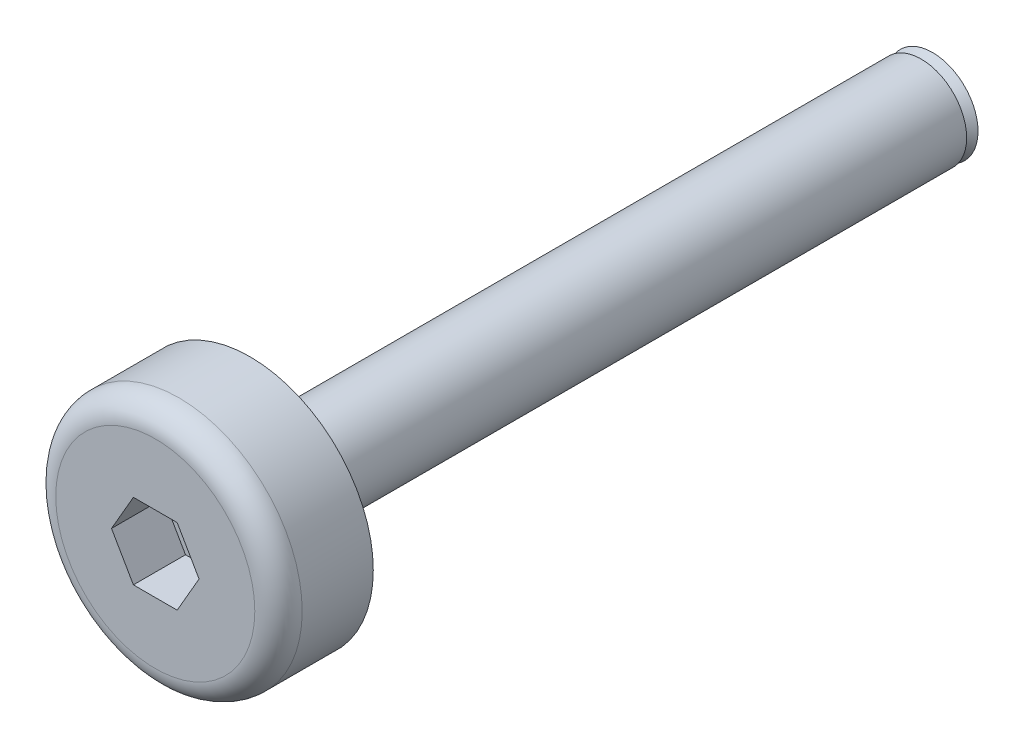
from build123d import *

# Parameters (mm, degrees)
F_0075_CYLINDER_SKETCH_R    = 3.25
F_0075_CYLINDER_DEPTH       = 2.5
F_0076_FILLET_R             = 0.625
F_0077_EXTRUDE_DEPTH        = 1.385
F_0077_EXTRUDE_ROTATE_ANGLE = 120
F_0080_CYLINDER_SKETCH_R    = 1.2
F_0080_CYLINDER_DEPTH       = 17.7
F_0081_CONE_ROTATE_ANGLE    = 90


with BuildPart() as part:
    # 0075_cylinder_Sketch → 0075_cylinder (new body)
    with BuildSketch(Plane.XY):
        Circle(F_0075_CYLINDER_SKETCH_R)
    extrude(amount=F_0075_CYLINDER_DEPTH)

    # 0076_fillet
    f_0076_fillet_edges = [part.edges().sort_by_distance(p)[0] for p in [
        (-3.25, 0, 2.5),
    ]]
    fillet(f_0076_fillet_edges, radius=F_0076_FILLET_R)


with BuildPart() as body_2:
    # 0077_extrude_Sketch → 0077_extrude (new body)
    with BuildSketch(Plane.XY):
        Polygon((0, 0), (1.154700538, 0), (1.732050808, 1), (1.154700538, 2), (0, 2), (-0.577350269, 1), align=None)
    extrude(amount=F_0077_EXTRUDE_DEPTH)


with BuildPart() as body_2_1:
    # 0077_extrude_Rotate: read off the stored shape, not the designer's step
    # 0077_extrude_Rotate: moved
    add(body_2.part.rotate(Axis((0, 0, 0), (0, 0, 1)), F_0077_EXTRUDE_ROTATE_ANGLE))


with BuildPart() as body_2_2:
    # 0077_extrude_Translate: moved
    add(body_2_1.part.moved(Location((1.154700538, 0, 1.125))))


with BuildPart() as part_1:
    add(part.part)

    # 0079_sub: cut body 2
    add(body_2_2.part, mode=Mode.SUBTRACT)


with BuildPart() as body_2_2_1:
    # 0080_cylinder_Sketch → 0080_cylinder (new body)
    with BuildSketch(Plane.XY):
        Circle(F_0080_CYLINDER_SKETCH_R)
    extrude(amount=F_0080_CYLINDER_DEPTH)


with BuildPart() as body_2_2_2:
    # 0080_cylinder_Translate: moved
    add(body_2_2_1.part.moved(Location((0, 0, -17.7))))


with BuildPart() as body_3:
    # 0081_cone_Sketch → 0081_cone (revolve)
    with BuildSketch(Plane.XY, mode=Mode.PRIVATE) as f_0081_cone_sk:
        Polygon((0, 0), (1.2, 0), (0.9, 0.3), (0, 0.3), align=None)
    revolve(f_0081_cone_sk.sketch.rotate(Axis((0, -100, 0), (0, 1, 0)), 90), axis=Axis((0, -100, 0), (0, 1, 0)))


with BuildPart() as body_3_1:
    # 0081_cone_Rotate: moved
    add(body_3.part.rotate(Axis((0, 0, 0), (1, 0, 0)), F_0081_CONE_ROTATE_ANGLE))


with BuildPart() as body_3_2:
    # 0081_cone_Translate: moved
    add(body_3_1.part.moved(Location((0, 0, -18))))


with BuildPart() as body_2_2_3:
    add(body_2_2_2.part)

    # 0083_add: union body 3
    add(body_3_2.part)


with BuildPart() as part_2:
    add(part_1.part)

    # 0084_add: union body 2 2
    add(body_2_2_3.part)


solid = part_2.part
